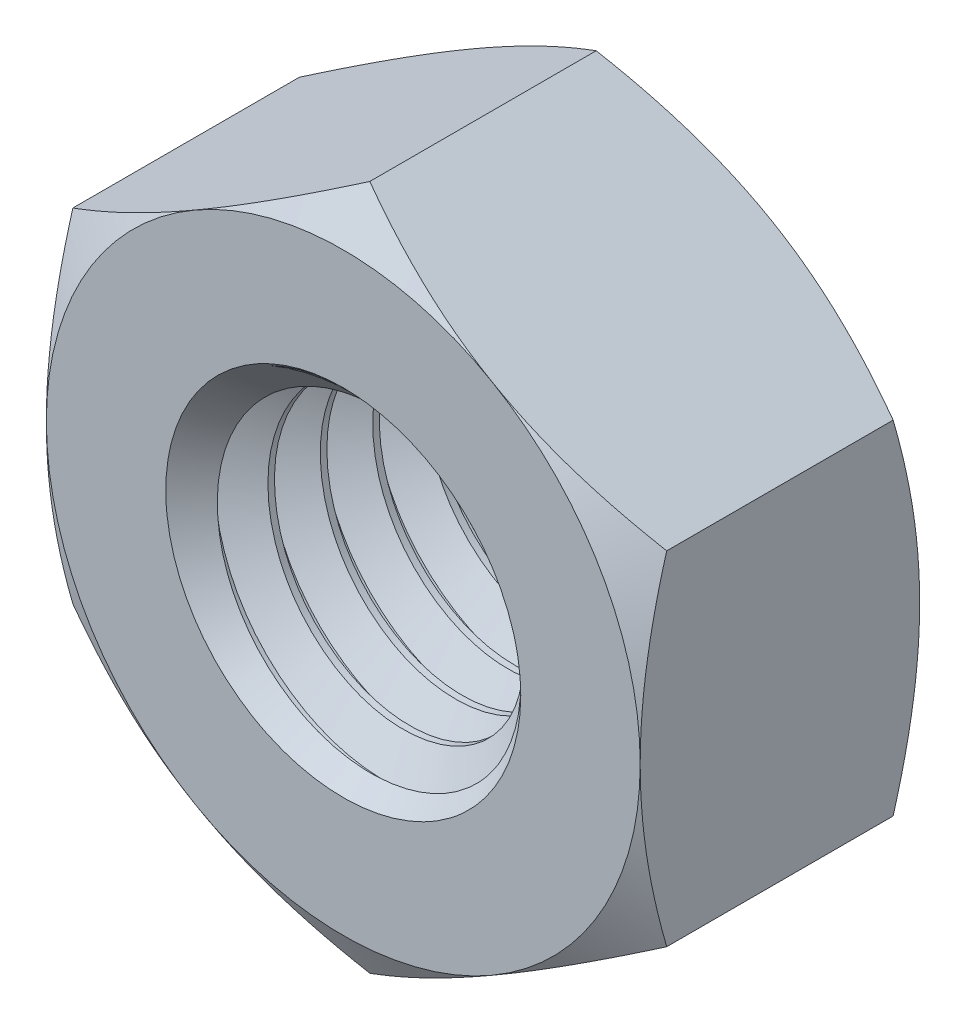
from build123d import *

# Parameters (mm, degrees)
BOSS_EXTRUDE1_DEPTH      = 4
BOSS_EXTRUDE1_DEPTH_BACK = 4
SKETCH2_R                = 5
SKETCH3_OUTSIDE_W        = 80.728
SKETCH3_OUTSIDE_H        = 83.358
SKETCH3_OUTSIDE_R        = 8.5
CUT_EXTRUDE1_DEPTH       = 16.250683045
CUT_EXTRUDE1_DRAFT       = -60
MIRROR1_COPY_1_SKETCH_W  = 80.728
MIRROR1_COPY_1_SKETCH_H  = 83.358
MIRROR1_COPY_1_SKETCH_R  = 8.5
MIRROR1_COPY_1_DEPTH     = 16.250683045
MIRROR1_COPY_1_DRAFT     = -60
SWEEP1_PITCH             = 1.5
SKETCH6_R                = 5.081189882
CUT_EXTRUDE2_DEPTH       = 17.116021817
SKETCH7_R                = 5.081189882
CUT_EXTRUDE3_DEPTH       = 16.250683153


with BuildPart() as part:
    # Sketch2 → Boss-Extrude1 (new, two sides: drawn at the far end of the back side and taken through both)
    with BuildSketch(Plane.XY.offset(-BOSS_EXTRUDE1_DEPTH_BACK)):
        Polygon((0, 9.814954576), (-8.5, 4.907477288), (-8.5, -4.907477288), (0, -9.814954576), (8.5, -4.907477288), (8.5, 4.907477288), align=None)
        Circle(SKETCH2_R, mode=Mode.SUBTRACT)
    extrude(amount=BOSS_EXTRUDE1_DEPTH + BOSS_EXTRUDE1_DEPTH_BACK)


with BuildPart() as cut_extrude1_tool:
    # Sketch3 outside → Cut-Extrude1 (with draft: the straight prism first)
    with BuildSketch(Plane.XY.offset(4)):
        Rectangle(SKETCH3_OUTSIDE_W, SKETCH3_OUTSIDE_H)
        Circle(SKETCH3_OUTSIDE_R, mode=Mode.SUBTRACT)
    extrude(amount=-CUT_EXTRUDE1_DEPTH)
    # Cut-Extrude1: the draft: its side faces are tilted about the plane it starts from
    cut_extrude1_sides = [cut_extrude1_tool.faces().sort_by_distance(p)[0] for p in [
        (0, -41.679, -4.125341522),
        (40.364, 0, -4.125341522),
        (0, 41.679, -4.125341522),
        (-40.364, 0, -4.125341522),
        (-8.5, 0, -4.125341522),
    ]]
    draft(cut_extrude1_sides, Plane.XY.offset(4), CUT_EXTRUDE1_DRAFT)


with BuildPart() as part_1:
    add(part.part)

    # Cut-Extrude1: cut by cut_extrude1_tool
    add(cut_extrude1_tool.part, mode=Mode.SUBTRACT)


with BuildPart() as mirror1_copy_1_tool:
    # Mirror1 copy 1 sketch → Mirror1 copy 1 (with draft: the straight prism first)
    with BuildSketch(Plane(origin=(0, 0, -4), x_dir=(1, 0, 0), z_dir=(0, 0, -1))):
        Rectangle(MIRROR1_COPY_1_SKETCH_W, MIRROR1_COPY_1_SKETCH_H)
        Circle(MIRROR1_COPY_1_SKETCH_R, mode=Mode.SUBTRACT)
    extrude(amount=-MIRROR1_COPY_1_DEPTH)
    # Mirror1 copy 1: the draft: its side faces are tilted about the plane it starts from
    mirror1_copy_1_sides = [mirror1_copy_1_tool.faces().sort_by_distance(p)[0] for p in [
        (0, -41.679, 4.125341522),
        (40.364, 0, 4.125341522),
        (0, 41.679, 4.125341522),
        (-40.364, 0, 4.125341522),
        (-8.5, 0, 4.125341522),
    ]]
    draft(mirror1_copy_1_sides, Plane(origin=(0, 0, -4), x_dir=(1, 0, 0), z_dir=(0, 0, -1)), MIRROR1_COPY_1_DRAFT)


with BuildPart() as part_2:
    add(part_1.part)

    # Mirror1 copy 1: cut by mirror1_copy_1_tool
    add(mirror1_copy_1_tool.part, mode=Mode.SUBTRACT)

    # Sweep1: arcs per turn and ends read off the stored shape
    # Sweep1: the profile of Sketch4 screwed along a right-hand helix through 6.333333 turns, 8 arcs to a turn; built about Z, then put on its axis
    sweep1_z = Axis((0, 0, 0), (0, 0, 1))
    sweep1_corners = [(5.081189882, 0, -1.359375), (4.025721421, 0, -0.75), (4.025721421, 0, -0.5625), (5.081189882, 0, 0.046875)]
    with BuildLine(mode=Mode.PRIVATE) as sweep1_profile:
        Line(sweep1_corners[0], sweep1_corners[1])
        Line(sweep1_corners[1], sweep1_corners[2])
        Line(sweep1_corners[2], sweep1_corners[3])
        Line(sweep1_corners[3], sweep1_corners[0])
    sweep1_cap = Face(sweep1_profile.wire())
    sweep1_turn_angles = [0, 22.5, 45, 67.5, 90, 112.5, 135, 157.5, 180, 202.5, 225, 247.5, 270, 292.5, 315, 337.5, 360]
    sweep1_turn_weights = [1, 0.9238795325112867, 1, 0.9238795325112867, 1, 0.9238795325112867, 1, 0.9238795325112867, 1, 0.9238795325112867, 1, 0.9238795325112867, 1, 0.9238795325112867, 1, 0.9238795325112867, 1]
    sweep1_turn_rails = [Edge.make_bspline([Vector(p[0], p[1], 0).rotate(sweep1_z, sweep1_turn_angles[k]) / sweep1_turn_weights[k] + Vector(0, 0, p[2] + SWEEP1_PITCH * sweep1_turn_angles[k] / 360) for k in range(17)], [0, 0, 0, 1, 1, 2, 2, 3, 3, 4, 4, 5, 5, 6, 6, 7, 7, 8, 8, 8], 2, sweep1_turn_weights) for p in sweep1_corners]
    sweep1_turn_sides = [Face.make_surface_from_curves(sweep1_turn_rails[p[0]], sweep1_turn_rails[p[1]]) for p in [(0, 1), (1, 2), (2, 3), (3, 0)]]
    sweep1_last_angles = [2160, 2182.5, 2205, 2227.5, 2250, 2265, 2280]
    sweep1_last_weights = [1, 0.9238795325112867, 1, 0.9238795325112867, 1, 0.9659258262890396, 1]
    sweep1_last_rails = [Edge.make_bspline([Vector(p[0], p[1], 0).rotate(sweep1_z, sweep1_last_angles[k]) / sweep1_last_weights[k] + Vector(0, 0, p[2] + SWEEP1_PITCH * sweep1_last_angles[k] / 360) for k in range(7)], [0, 0, 0, 1, 1, 2, 2, 3, 3, 3], 2, sweep1_last_weights) for p in sweep1_corners]
    sweep1_last_sides = [Face.make_surface_from_curves(sweep1_last_rails[p[0]], sweep1_last_rails[p[1]]) for p in [(0, 1), (1, 2), (2, 3), (3, 0)]]
    sweep1 = Plane(origin=(0, 0, 4), x_dir=(0, 1, 0), z_dir=(0, 0, -1)) * Solid(Shell([*[p.moved(Location((0, 0, SWEEP1_PITCH * i))) for i in range(6) for p in sweep1_turn_sides], *sweep1_last_sides, sweep1_cap, sweep1_cap.rotate(sweep1_z, 2280).moved(Location((0, 0, SWEEP1_PITCH * 2280 / 360)))]))
    add(sweep1)

    # Sketch6 → Cut-Extrude2 (cut)
    with BuildSketch(Plane.XY.offset(4)):
        Circle(SKETCH6_R)
    extrude(amount=CUT_EXTRUDE2_DEPTH, mode=Mode.SUBTRACT)

    # Cut-Extrude2 cone 1 section (through the dimple's axis) → Cut-Extrude2 other way (revolve, cut)
    with BuildSketch(Plane(origin=(0, 0, 4), x_dir=(0, -1, 0), z_dir=(1, 0, 0))):
        Polygon((0, 0), (5.081189882, 0), (0, 5.081189882), align=None)
    revolve(axis=Axis((0, 0, 4), (0, 0, -1)), mode=Mode.SUBTRACT)

    # Sketch7 → Cut-Extrude3 (cut)
    with BuildSketch(Plane(origin=(0, 0, -4), x_dir=(-1, 0, 0), z_dir=(0, 0, -1))):
        Circle(SKETCH7_R)
    extrude(amount=CUT_EXTRUDE3_DEPTH, mode=Mode.SUBTRACT)

    # Cut-Extrude3 cone 1 section (through the dimple's axis) → Cut-Extrude3 other way (revolve, cut)
    with BuildSketch(Plane(origin=(0, 0, -4), x_dir=(0, 1, 0), z_dir=(1, 0, 0))):
        Polygon((0, 0), (5.081189882, 0), (0, 5.081189882), align=None)
    revolve(axis=Axis((0, 0, -4), (0, 0, 1)), mode=Mode.SUBTRACT)


solid = part_2.part
